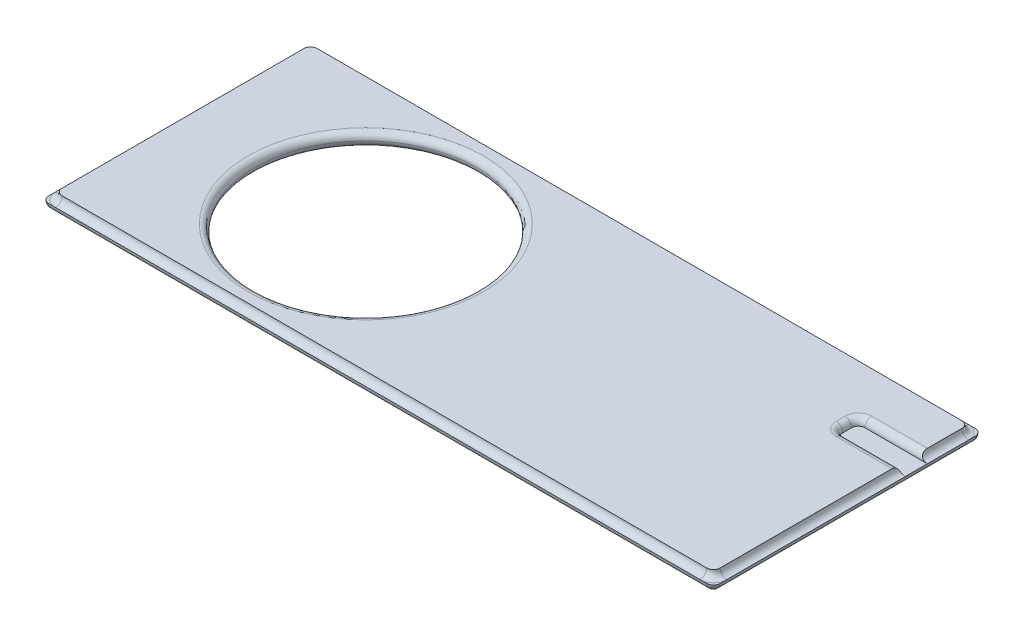
from build123d import *

# Parameters (mm, degrees)
SKETCH1_W           = 200
SKETCH1_H           = 80
BOSS_EXTRUDE1_DEPTH = 2
SKETCH2_W           = 196
SKETCH2_H           = 76
BOSS_EXTRUDE2_DEPTH = 2
FILLET1_R           = 2
FILLET2_R           = 2
FILLET3_R           = 2
SKETCH3_R           = 33.072163117
CUT_EXTRUDE1_DEPTH  = 25
FILLET4_R           = 2
FILLET5_R           = 2
SKETCH4_W           = 18.581197799
SKETCH4_H           = 6.58
CUT_EXTRUDE3_DEPTH  = 2
SKETCH5_W           = 3.741738876
SKETCH5_H           = 6.58
CUT_EXTRUDE4_DEPTH  = 2
FILLET6_R           = 2
FILLET7_R           = 2


with BuildPart() as part:
    # Sketch1 → Boss-Extrude1 (new body)
    with BuildSketch(Plane(origin=(0, 0, 0), x_dir=(1, 0, 0), z_dir=(0, 1, 0))):
        Rectangle(SKETCH1_W, SKETCH1_H)
    extrude(amount=BOSS_EXTRUDE1_DEPTH)

    # Sketch2 → Boss-Extrude2 (add)
    with BuildSketch(Plane(origin=(0, 2, 0), x_dir=(1, 0, 0), z_dir=(0, 1, 0))):
        Rectangle(SKETCH2_W, SKETCH2_H)
    extrude(amount=BOSS_EXTRUDE2_DEPTH)

    # Fillet1
    fillet1_edges = [part.edges().sort_by_distance(p)[0] for p in [
        (-100, 1, -40),
        (100, 1, -40),
        (100, 1, 40),
        (-100, 1, 40),
    ]]
    fillet(fillet1_edges, radius=FILLET1_R)

    # Fillet2
    fillet2_edges = [part.edges().sort_by_distance(p)[0] for p in [
        (-98, 3, -38),
        (-98, 3, 38),
        (98, 3, 38),
        (98, 3, -38),
    ]]
    fillet(fillet2_edges, radius=FILLET2_R)

    # Fillet3
    fillet3_edges = [part.edges().sort_by_distance(p)[0] for p in [
        (-99.414213562, 0, -39.414213562),
        (0, 0, -40),
        (99.414213562, 0, -39.414213562),
        (100, 0, 0),
        (99.414213562, 0, 39.414213562),
        (0, 0, 40),
        (-99.414213562, 0, 39.414213562),
        (-97.414213562, 2, 37.414213562),
        (-98, 2, 0),
        (-97.414213562, 2, -37.414213562),
        (0, 2, -38),
        (97.414213562, 2, -37.414213562),
        (98, 2, 0),
        (97.414213562, 2, 37.414213562),
        (-100, 0, 0),
        (0, 2, 38),
    ]]
    fillet(fillet3_edges, radius=FILLET3_R - 0.0001)  # a hair under: the kernel refuses the full size

    # Sketch3 → Cut-Extrude1 (cut)
    with BuildSketch(Plane.XZ):
        with Locations(Location((-43.56, 0, 0), (0, 0, 270))):
            Circle(SKETCH3_R)
    extrude(amount=-CUT_EXTRUDE1_DEPTH, mode=Mode.SUBTRACT)

    # Fillet4
    fillet4_edges = [part.edges().sort_by_distance(p)[0] for p in [
        (-43.56, 0, 33.072163117),
    ]]
    fillet(fillet4_edges, radius=FILLET4_R)

    # Fillet5
    fillet5_edges = [part.edges().sort_by_distance(p)[0] for p in [
        (-43.56, 4, 33.072163117),
    ]]
    fillet(fillet5_edges, radius=FILLET5_R - 0.0001)  # a hair under: the kernel refuses the full size

    # Sketch4 → Cut-Extrude3 (cut)
    with BuildSketch(Plane(origin=(0, 4, 0), x_dir=(1, 0, 0), z_dir=(0, 1, 0))):
        with Locations((88.709401101, 20.450898194)):
            Rectangle(SKETCH4_W, SKETCH4_H)
    extrude(amount=-CUT_EXTRUDE3_DEPTH, mode=Mode.SUBTRACT)

    # Sketch5 → Cut-Extrude4 (cut)
    with BuildSketch(Plane(origin=(0, 2, 0), x_dir=(1, 0, 0), z_dir=(0, 1, 0))):
        with Locations((99.870869438, 20.450898194)):
            Rectangle(SKETCH5_W, SKETCH5_H)
    extrude(amount=CUT_EXTRUDE4_DEPTH, mode=Mode.SUBTRACT)

    # Fillet6
    fillet6_edges = [part.edges().sort_by_distance(p)[0] for p in [
        (79.418802201, 3, -17.160898194),
        (79.418802201, 3, -23.740898194),
    ]]
    fillet(fillet6_edges, radius=FILLET6_R)

    # Fillet7
    fillet7_edges = [part.edges().sort_by_distance(p)[0] for p in [
        (80.004588639, 4, -17.746684631),
        (80.004588639, 4, -23.155111756),
        (79.418802201, 4, -20.450898194),
        (89.709401101, 4, -17.160898194),
        (89.709401101, 4, -23.740898194),
    ]]
    fillet(fillet7_edges, radius=FILLET7_R - 0.0001)  # a hair under: the kernel refuses the full size


solid = part.part
